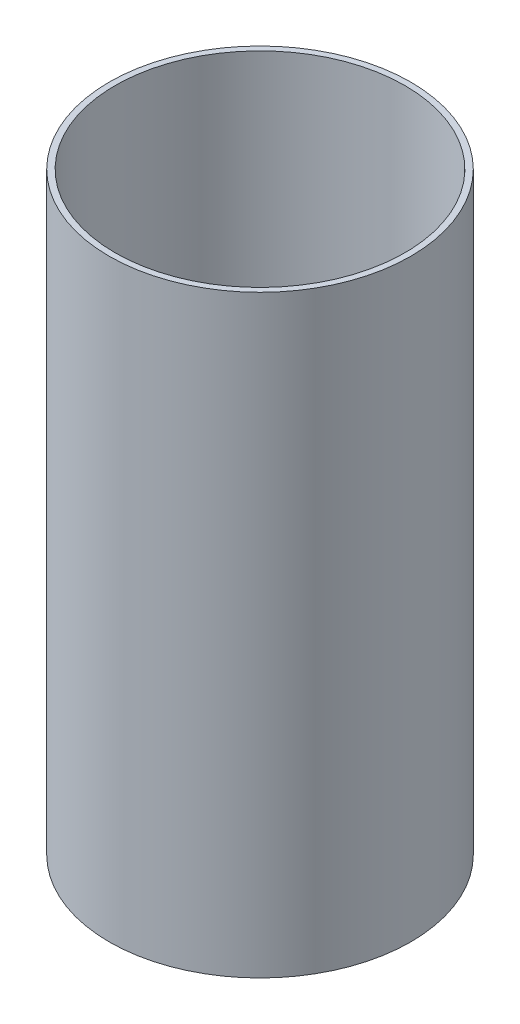
from build123d import *

# Parameters (mm, degrees)
BOSS_EXTRUDE1_DEPTH      = 150
BOSS_EXTRUDE1_DEPTH_BACK = 150
SKETCH1_R                = 76.2
SKETCH1_R_2              = 73.2


with BuildPart() as part:
    # Sketch1 → Boss-Extrude1 (new, two sides: drawn at the far end of the back side and taken through both)
    with BuildSketch(Plane(origin=(0, 0, 0), x_dir=(1, 0, 0), z_dir=(0, 1, 0)).offset(-BOSS_EXTRUDE1_DEPTH_BACK)):
        Circle(SKETCH1_R)
        Circle(SKETCH1_R_2, mode=Mode.SUBTRACT)
    extrude(amount=BOSS_EXTRUDE1_DEPTH + BOSS_EXTRUDE1_DEPTH_BACK)


solid = part.part
